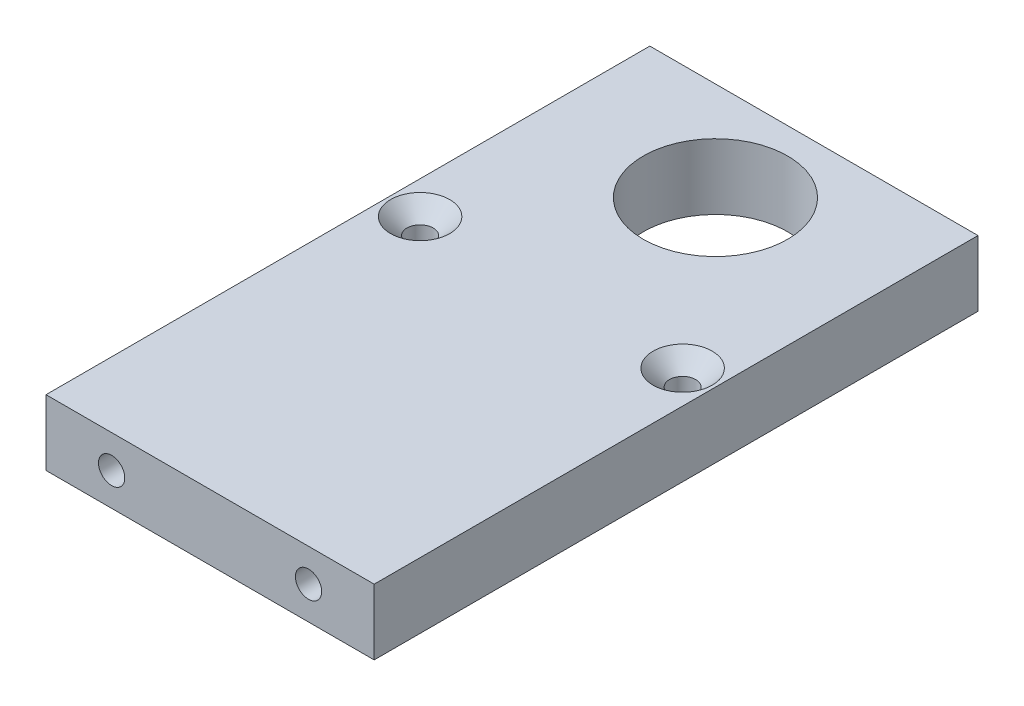
from build123d import *

# Parameters (mm, degrees)
ESQUISSE1_W             = 50
ESQUISSE1_H             = 92
ESQUISSE1_R             = 11
ESQUISSE1_R_2           = 2
BOSS_EXTRU_1_DEPTH      = 10
CHANFREIN1_SIZE         = 2.5
ESQUISSE2_R             = 2
ENL_V_MAT_EXTRU_1_DEPTH = 10
ESQUISSE3_R             = 11
ENL_V_MAT_EXTRU_2_DEPTH = 7


with BuildPart() as part:
    # Esquisse1 → Boss.-Extru.1 (new body)
    with BuildSketch(Plane(origin=(0, 0, 0), x_dir=(1, 0, 0), z_dir=(0, 1, 0))):
        with Locations((-6.491408935, -26.117918819)):
            Rectangle(ESQUISSE1_W, ESQUISSE1_H)
        with Locations((-6.491408935, 4.882081181)):
            Circle(ESQUISSE1_R, mode=Mode.SUBTRACT)
        with Locations((-26.491408935, -20.117918819)):
            Circle(ESQUISSE1_R_2, mode=Mode.SUBTRACT)
        with Locations((13.508591065, -20.117918819)):
            Circle(ESQUISSE1_R_2, mode=Mode.SUBTRACT)
    extrude(amount=BOSS_EXTRU_1_DEPTH)

    # Chanfrein1
    chanfrein1_edges = [part.edges().sort_by_distance(p)[0] for p in [
        (11.508591065, 10, 20.117918819),
        (-28.491408935, 10, 20.117918819),
    ]]
    chamfer(chanfrein1_edges, length=CHANFREIN1_SIZE)

    # Esquisse2 → Enlèv. mat.-Extru.1 (cut)
    with BuildSketch(Plane.XY.offset(72.117918819)):
        with Locations((-21.491408935, 5)):
            Circle(ESQUISSE2_R)
        with Locations((8.508591065, 5)):
            Circle(ESQUISSE2_R)
    extrude(amount=-ENL_V_MAT_EXTRU_1_DEPTH, mode=Mode.SUBTRACT)

    # Esquisse3 → Enlèv. mat.-Extru.2 (cut)
    with BuildSketch(Plane.XZ):
        with Locations((-6.491408935, 57.117918819)):
            Circle(ESQUISSE3_R)
    extrude(amount=-ENL_V_MAT_EXTRU_2_DEPTH, mode=Mode.SUBTRACT)


solid = part.part
